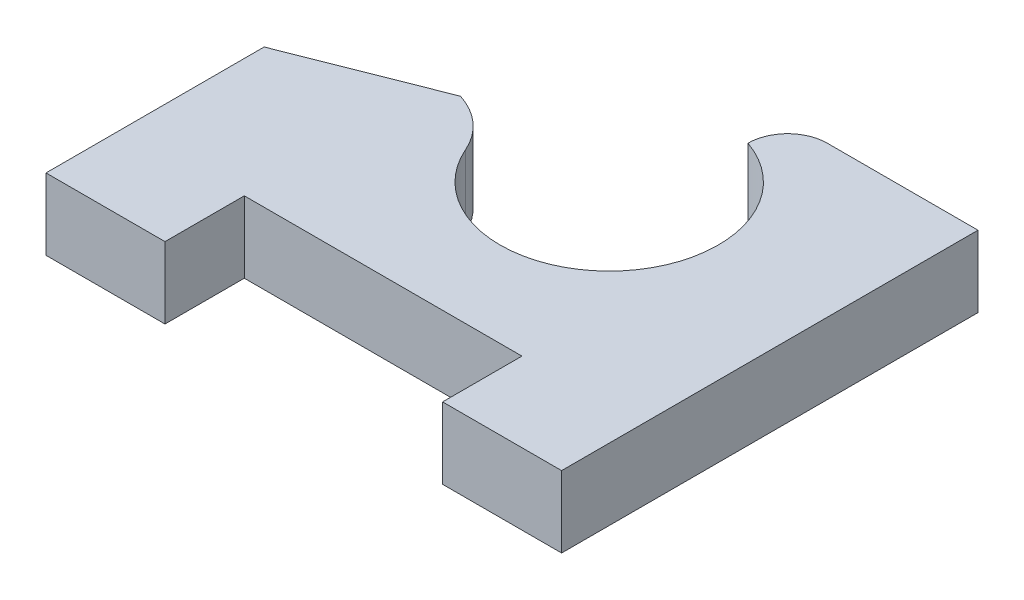
from build123d import *

# Parameters (mm, degrees)
BOSS_EXTRUDE1_DEPTH = 1.8
FILLET1_R           = 2
FILLET3_R           = 1


# Some blends are built 0.0001 mm under size
with BuildPart() as part:
    # Sketch1 → Boss-Extrude1 (new body)
    with BuildSketch(Plane(origin=(0, 0, 0), x_dir=(1, 0, 0), z_dir=(0, 1, 0))):
        with BuildLine():
            Line((6.5, 2.5), (6.5, 0))
            Line((6.5, 0), (6.5, -2))
            Line((6.5, -2), (3.5, -2))
            Line((3.5, -2), (3.5, 0))
            Line((3.5, 0), (-3.5, 0))
            Line((-3.5, 0), (-3.5, -2))
            Line((-3.5, -2), (-6.5, -2))
            Line((-6.5, -2), (-6.5, 0))
            Line((-6.5, 0), (-6.5, 2.5))
            Line((-6.5, 2.5), (-6.5, 3.5))
            Line((-6.5, 3.5), (-2.95, 4.9))
            Line((-2.95, 4.9), (-1.95, 4.9))
            ThreePointArc((-1.95, 4.9), (0.286343304, 2.198397365), (3.358114035, 3.890766339))
            ThreePointArc((3.358114035, 3.890766339), (3.298735092, 6.048400165), (1.7, 7.498557292))
            Line((1.7, 7.498557292), (1.7, 8.498557292))
            Line((1.7, 8.498557292), (6.5, 8.498557292))
            Line((6.5, 8.498557292), (6.5, 4.9))
            Line((6.5, 4.9), (6.5, 2.5))
        make_face()
    extrude(amount=BOSS_EXTRUDE1_DEPTH)

    # Fillet1
    # the kernel refuses this fillet: 2 mm, written as the material it takes off along each edge
    with BuildSketch(Plane(origin=(-1.95, -2.821440468, -4.9), x_dir=(0.20519567041703063, 0, 0.9787209698591859), z_dir=(0, 1, 0))) as fillet1_piece_1:
        with BuildLine():
            CenterArc((1.538967528, -1.95744194), FILLET1_R, 101.840953646, 48.860489585)
            Line((-0.20519567, -0.97872097), (-0.240078934, -0.95914655))
            ThreePointArc((-0.240078934, -0.95914655), (-0.141746674, -0.481152658), (-0.039148839, 0.008207827))
            Line((-0.039148839, 0.008207827), (0.008207827, 0.039148839))
            ThreePointArc((0.008207827, 0.039148839), (0.564288094, -0.018517333), (1.12036836, 0.039148839))
            Line((1.12036836, 0.039148839), (1.128576187, 0))
        make_face()
    extrude(amount=7.442880936, mode=Mode.SUBTRACT)

    # Fillet3
    fillet3_edges = [part.edges().sort_by_distance(p)[0] for p in [
        (1.7, 0.9, -8.498557292),
    ]]
    fillet(fillet3_edges, radius=FILLET3_R - 0.0001)  # a hair under: the kernel refuses the full size


solid = part.part
